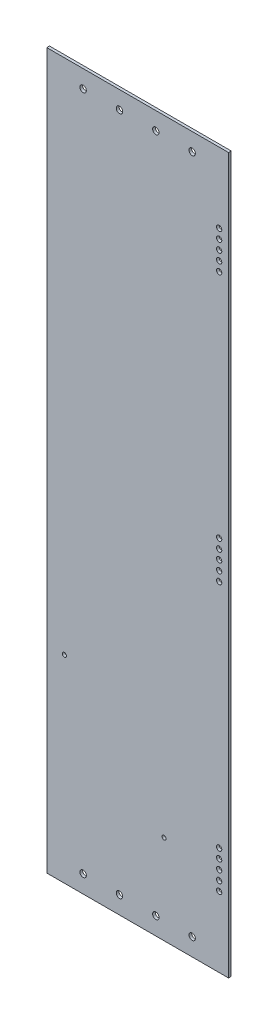
from build123d import *

# Parameters (mm, degrees)
SKETCH1_W                  = 155
SKETCH1_H                  = 609.6
BOSS_EXTRUDE1_DEPTH        = 2.305
M4_CLEARANCE_HOLE1_D       = 4.5
M5_CLEARANCE_HOLE1_D       = 5.5
F_3_5_3_5_DIAMETER_HOLE1_D = 3.5


with BuildPart() as part:
    # Sketch1 → Boss-Extrude1 (new body)
    with BuildSketch(Plane.XY):
        Rectangle(SKETCH1_W, SKETCH1_H)
    extrude(amount=BOSS_EXTRUDE1_DEPTH)

    # M4 Clearance Hole1 (through all)
    with Locations(Plane.XY.offset(2.305)):
        with Locations((69.5, 228.8), (69.5, 244.8), (69.5, 236.8), (69.5, 220.8), (69.5, 212.8), (69.5, 16), (69.5, 8), (69.5, 0), (69.5, -8), (69.5, -16), (69.5, -212.8), (69.5, -220.8), (69.5, -228.8), (69.5, -236.8), (69.5, -244.8)):
            Hole(M4_CLEARANCE_HOLE1_D / 2)

    # M5 Clearance Hole1 (through all)
    with Locations(Plane.XY.offset(2.305)):
        with Locations((-46.5, -289.795), (-15.5, -289.795), (15.5, -289.795), (46.5, -289.795), (-46.5, 289.795), (-15.5, 289.795), (15.5, 289.795), (46.5, 289.795)):
            Hole(M5_CLEARANCE_HOLE1_D / 2)

    # Ø3.5 (3.5) Diameter Hole1 (through all)
    with Locations(Plane(origin=(0, 0, 0), x_dir=(-1, 0, 0), z_dir=(0, 0, -1))):
        with Locations((-22.5, -228.6), (62.5, -136.1)):
            Hole(F_3_5_3_5_DIAMETER_HOLE1_D / 2)


solid = part.part
